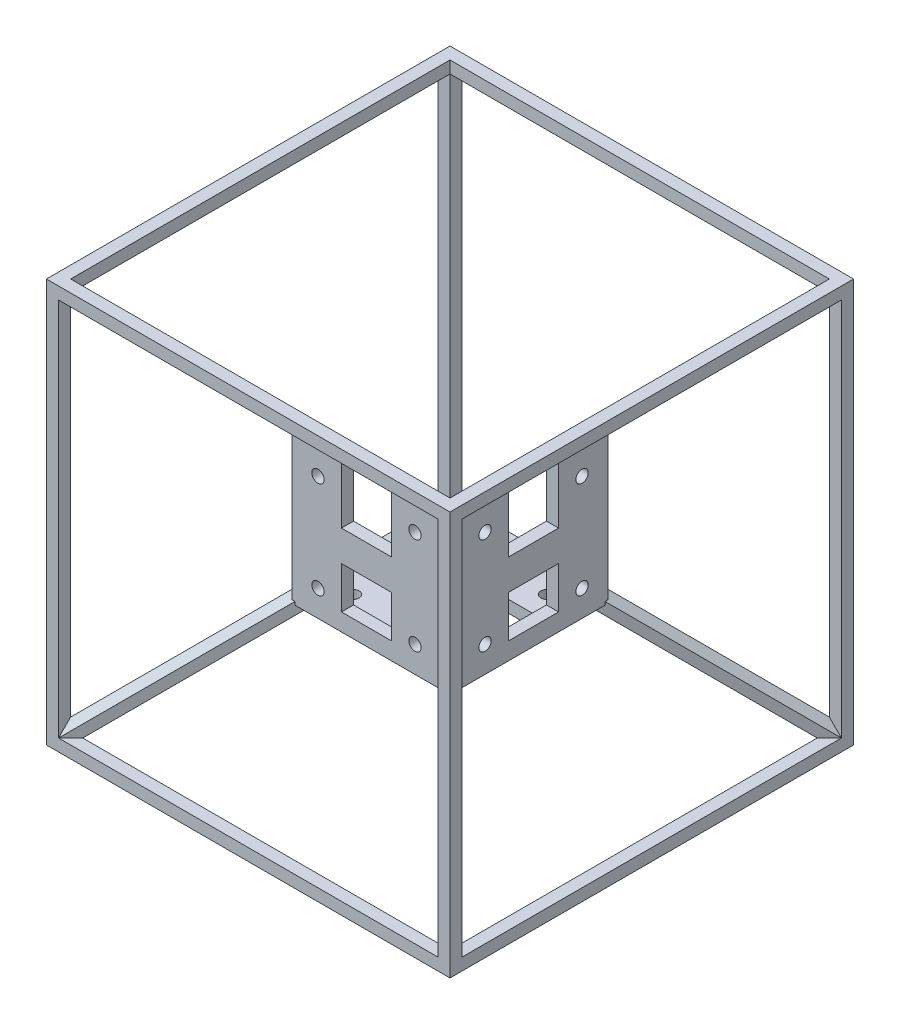
from build123d import *

# Parameters (mm, degrees)
SKETCH1_W               = 100
SKETCH1_H               = 100
SKETCH1_W_2             = 94
SKETCH1_H_2             = 94
BOSS_EXTRUDE1_DEPTH     = 3
SKETCH2_R               = 1.525
SKETCH2_W               = 12.4
SKETCH2_H               = 10.4
BOSS_EXTRUDE3_DEPTH     = 3
BODY_MOVE_COPY2_ANGLE   = 90
BODY_MOVE_COPY2_2_ANGLE = 90
BODY_MOVE_COPY4_ANGLE   = 120
BODY_MOVE_COPY4_2_ANGLE = 120
BODY_MOVE_COPY6_ANGLE   = 180
BODY_MOVE_COPY6_2_ANGLE = 180
BODY_MOVE_COPY6_3_ANGLE = 90
BOSS_EXTRUDE5_DEPTH     = 60
MIRROR4_COPY_1_DEPTH    = 60
MIRROR5_START           = -56.002976111
MIRROR5_DEPTH           = 60
MIRROR5_2_DEPTH         = 60
MIRROR5_START_2         = -110.273901415
MIRROR5_3_DEPTH         = 60
SKETCH7_W               = 36.2
SKETCH7_H               = 36.2
CUT_EXTRUDE1_DEPTH      = 36.2
FILLET3_R               = 2
FILLET4_R               = 1.5
FILLET5_R               = 1.5


with BuildPart() as part:
    # Sketch1 → Boss-Extrude1 (new body)
    with BuildSketch(Plane.XY):
        Rectangle(SKETCH1_W, SKETCH1_H)
        Rectangle(SKETCH1_W_2, SKETCH1_H_2, mode=Mode.SUBTRACT)
    extrude(amount=BOSS_EXTRUDE1_DEPTH)


with BuildPart() as body_2:
    # Sketch2 → Boss-Extrude3 (new body)
    with BuildSketch(Plane(origin=(0, 0, -26.3), x_dir=(-1, 0, 0), z_dir=(0, 0, -1))):
        Polygon((-18.5, 18.5), (-6.2, 18.5), (-6.2, 3.8), (6.2, 3.8), (6.2, 18.5), (18.5, 18.5), (18.5, -18.5), (-18.5, -18.5), align=None)
        with Locations((-12.02081528, 12.02081528)):
            Circle(SKETCH2_R, mode=Mode.SUBTRACT)
        with Locations((12.02081528, 12.02081528)):
            Circle(SKETCH2_R, mode=Mode.SUBTRACT)
        with Locations((12.02081528, -12.02081528)):
            Circle(SKETCH2_R, mode=Mode.SUBTRACT)
        with Locations((-12.02081528, -12.02081528)):
            Circle(SKETCH2_R, mode=Mode.SUBTRACT)
        with Locations((0, -9)):
            Rectangle(SKETCH2_W, SKETCH2_H, mode=Mode.SUBTRACT)
    extrude(amount=BOSS_EXTRUDE3_DEPTH)


with BuildPart() as body_3:
    # Body-Move/Copy2: read off the stored shape, not the designer's step
    # Body-Move/Copy2: copy of part
    add(part.part.moved(Location((26.5, 0, 26.5))).rotate(Axis((0, 0, 0), (0, 1, 0)), BODY_MOVE_COPY2_ANGLE))


with BuildPart() as body_4:
    # Body-Move_Copy2 2: copy of body 2
    add(body_2.part.moved(Location((26.5, 0, 26.5))).rotate(Axis((0, 0, 0), (0, 1, 0)), BODY_MOVE_COPY2_2_ANGLE))


with BuildPart() as body_4_1:
    # Body-Move/Copy3: moved
    add(body_4.part.moved(Location((20.5, 0, -20.5))))


with BuildPart() as body_3_1:
    # Body-Move/Copy3: moved
    add(body_3.part.moved(Location((20.5, 0, -20.5))))


with BuildPart() as body_5:
    # Body-Move/Copy4: read off the stored shape, not the designer's step
    # Body-Move/Copy4: copy of body 2
    add(body_2.part.moved(Location((47, 33.5, 13.5))).rotate(Axis((0, 0, 0), (0.5773502692, 0.5773502692, -0.5773502692)), BODY_MOVE_COPY4_ANGLE))


with BuildPart() as body_6:
    # Body-Move_Copy4 2: copy of part
    add(part.part.moved(Location((47, 33.5, 13.5))).rotate(Axis((0, 0, 0), (0.5773502692, 0.5773502692, -0.5773502692)), BODY_MOVE_COPY4_2_ANGLE))


with BuildPart() as body_6_1:
    # Body-Move/Copy5: moved
    add(body_6.part.moved(Location((-33.5, -33.5, 0))))


with BuildPart() as body_5_1:
    # Body-Move/Copy5: moved
    add(body_5.part.moved(Location((-33.5, -33.5, 0))))


with BuildPart() as body_7:
    # Body-Move/Copy6: read off the stored shape, not the designer's step
    # Body-Move/Copy6: copy of part
    add(part.part.moved(Location((32.3333333, 32.3333333, 61.6666667))).rotate(Axis((0, 0, 0), (1, 0, 0)), BODY_MOVE_COPY6_ANGLE))


with BuildPart() as body_8:
    # Body-Move_Copy6 2: copy of part
    add(part.part.moved(Location((14.6666667, 32.3333333, 14.6666667))).rotate(Axis((0, 0, 0), (0.7071067812, 0, -0.7071067812)), BODY_MOVE_COPY6_2_ANGLE))


with BuildPart() as body_9:
    # Body-Move_Copy6 3: copy of part
    add(part.part.moved(Location((32.3333333, 14.6666667, 14.6666667))).rotate(Axis((0, 0, 0), (-1, 0, 0)), BODY_MOVE_COPY6_3_ANGLE))


with BuildPart() as body_9_1:
    # Body-Move/Copy7: moved
    add(body_9.part.moved(Location((-32.333333333, 32.333333333, -32.333333333))))


with BuildPart() as body_8_1:
    # Body-Move/Copy7: moved
    add(body_8.part.moved(Location((-32.333333333, 32.333333333, -32.333333333))))


with BuildPart() as body_7_1:
    # Body-Move/Copy7: moved
    add(body_7.part.moved(Location((-32.333333333, 32.333333333, -32.333333333))))


with BuildPart() as part_1:
    add(part.part)

    add(body_2.part)  # Boss-Extrude5 merges body 2

    add(body_3_1.part)  # Boss-Extrude5 merges body 3

    add(body_4_1.part)  # Boss-Extrude5 merges body 4

    add(body_5_1.part)  # Boss-Extrude5 merges body 5

    add(body_6_1.part)  # Boss-Extrude5 merges body 6
    # Sketch6 → Boss-Extrude5 (add)
    with BuildSketch(Plane(origin=(32.333333333, -32.333333333, 32.333333333), x_dir=(-0.8164965809277254, -0.4082482904638657, 0.4082482904638618), z_dir=(0.5773502691896268, -0.5773502691896281, 0.5773502691896226))):
        Polygon((-21.637159395, 33.234018716), (-20.412414523, 35.355339059), (-17.96292478, 35.355339059), (-16.738179909, 33.234018716), (-17.96292478, 31.112698372), (-20.412414523, 31.112698372), align=None)
    boss_extrude5 = extrude(amount=-BOSS_EXTRUDE5_DEPTH)

    # Mirror3: Boss-Extrude5 across plane
    add(boss_extrude5.mirror(Plane.ZX))

    # Mirror4: Boss-Extrude5 across plane
    add(boss_extrude5.mirror(Plane.XY.offset(-47)))

    # Mirror4 copy 1 sketch → Mirror4 copy 1 (add)
    with BuildSketch(Plane(origin=(32.333333333, 32.333333333, -126.333333333), x_dir=(-0.8164965809277254, 0.4082482904638657, -0.4082482904638618), z_dir=(0.5773502691896268, 0.5773502691896281, -0.5773502691896226))):
        Polygon((-21.637159395, 33.234018716), (-20.412414523, 35.355339059), (-17.96292478, 35.355339059), (-16.738179909, 33.234018716), (-17.96292478, 31.112698372), (-20.412414523, 31.112698372), align=None)
    extrude(amount=-MIRROR4_COPY_1_DEPTH)

    # Mirror5: read off the stored shape, not the designer's step
    # Mirror5 outline → Mirror5 (add)
    with BuildSketch(Plane(origin=(0, 0, 0), x_dir=(0.8164965809277244, -0.4082482904638664, 0.4082482904638628), z_dir=(0.5773502691896281, 0.5773502691896272, -0.5773502691896221)).offset(MIRROR5_START)):
        Polygon((-17.96292478, 35.355339059), (-20.412414523, 35.355339059), (-21.637159395, 33.234018716), (-20.412414523, 31.112698372), (-17.96292478, 31.112698372), (-16.738179909, 33.234018716), align=None)
    extrude(amount=MIRROR5_DEPTH)

    # Mirror5 2 outline → Mirror5 2 (add)
    with BuildSketch(Plane(origin=(0, 0, 0), x_dir=(0.8164965809277244, 0.4082482904638664, 0.4082482904638628), z_dir=(0.5773502691896281, -0.5773502691896272, -0.5773502691896221)).offset(MIRROR5_START)):
        Polygon((-17.96292478, -31.112698372), (-20.412414523, -31.112698372), (-21.637159395, -33.234018716), (-20.412414523, -35.355339059), (-17.96292478, -35.355339059), (-16.738179909, -33.234018716), align=None)
    extrude(amount=MIRROR5_2_DEPTH)

    # Mirror5 3 outline → Mirror5 3 (add)
    with BuildSketch(Plane(origin=(0, 0, 0), x_dir=(0.8164965809277244, -0.4082482904638664, -0.4082482904638628), z_dir=(0.5773502691896281, 0.5773502691896272, 0.5773502691896221)).offset(MIRROR5_START_2)):
        Polygon((20.412414523, 31.112698372), (21.637159395, 33.234018716), (20.412414523, 35.355339059), (17.96292478, 35.355339059), (16.738179909, 33.234018716), (17.96292478, 31.112698372), align=None)
    extrude(amount=MIRROR5_3_DEPTH)

    # Sketch7 → Cut-Extrude1 (cut)
    with BuildSketch(Plane.ZY.offset(-17.7)):
        with Locations((-47.4, 0.4)):
            Rectangle(SKETCH7_W, SKETCH7_H)
    extrude(amount=CUT_EXTRUDE1_DEPTH, mode=Mode.SUBTRACT)

    # Fillet3
    fillet3_edges = [part_1.edges().sort_by_distance(p)[0] for p in [
        (18.5, -18.5, -57.85),
        (18.5, -18.5, -36.15),
        (0, -18.5, -28.5),
        (18.5, 0, -28.5),
    ]]
    fillet(fillet3_edges, radius=FILLET3_R)

    # Fillet4
    # the kernel refuses this fillet: 1.5 mm, written as the material it takes off along each edge
    with BuildSketch(Plane(origin=(-18.5, -17.7, -31.5), x_dir=(-0.7071067813210047, 2.6890289984470006e-10, 0.7071067810520903), z_dir=(0, 1.0, -3.8028612799414204e-10))) as fillet4_piece_1:
        with BuildLine():
            CenterArc((3.054602815, 1.5), FILLET4_R, 177.87441509, 92.12558491)
            Line((1.555634918, 1.555634919), (0, 0))
            Line((0, 0), (3.054602815, 0))
        make_face()
    extrude(amount=9.836507039, mode=Mode.SUBTRACT)
    with BuildSketch(Plane(origin=(-18.5, -15.499999999, -39.136507039), x_dir=(-8.54266152693293e-13, -1.0, -1.4458914919482245e-10), z_dir=(3.4914813388431337e-15, -1.4458914919482245e-10, 1.0)), Plane(origin=(15.5, -7.863492961, -65.5), x_dir=(1.0, -7.811209981951868e-15, -1.0528951448071048e-12), z_dir=(0, -1, 0))) as fillet4_piece_2:
        with BuildLine():
            CenterArc((3.220590536, -1.099270193), FILLET4_R, 132.874415095, 92.125584901)
            Line((2.159930365, -2.159930365), (0, 0))
            Line((0, 0), (2.2, 0))
        make_face()
    extrude(amount=9.836507039, mode=Mode.SUBTRACT)
    with BuildSketch(Plane(origin=(17.7, -15.5, -65.5), x_dir=(-8.431864652285498e-14, -0.7071067811865127, -0.7071067811865824), z_dir=(-1, 0, 0)), Plane(origin=(7.863492961, 18.5, -31.5), x_dir=(-8.049116928531383e-14, 0.7071067811865916, 0.7071067811865033), z_dir=(1, 0, 0)), Plane(origin=(15.5, 18.5, -29.3), x_dir=(0.7071067811864652, 0.7071067811866297, -1.636191182540943e-13), z_dir=(0, 0, -1))) as fillet4_piece_3:
        with BuildLine():
            CenterArc((3.054602815, 1.5), FILLET4_R, 177.874415108, 92.125584892)
            Line((1.555634919, 1.555634919), (0, 0))
            Line((0, 0), (3.054602815, 0))
        make_face()
    extrude(amount=9.836507039, mode=Mode.SUBTRACT)

    # Fillet5
    # the kernel refuses this fillet: 1.5 mm, written as the material it adds along each edge
    with BuildSketch(Plane(origin=(17.7, 11.75, -65.5), x_dir=(-1, 0, 0), z_dir=(0, 1, 0))) as fillet5_piece_1_section:
        with BuildLine():
            CenterArc((FILLET5_R, FILLET5_R), FILLET5_R, 180, 90)
            Line((0, FILLET5_R), (0, 0))
            Line((0, 0), (FILLET5_R, 0))
        make_face()
    fillet5_piece_1 = extrude(amount=6.75, mode=Mode.PRIVATE)
    fillet5_piece_1 = split(fillet5_piece_1, bisect_by=Plane(origin=(17.7, 13.625, -63.625), z_dir=(-7.940870183631432e-14, 0.7071067811865839, 0.7071067811865112)), keep=Keep.TOP, mode=Mode.PRIVATE)
    add(fillet5_piece_1)
    with BuildSketch(Plane(origin=(17.7, 18.5, -69.25), x_dir=(-1, 0, 0), z_dir=(0, 0, 1))) as fillet5_piece_2_section:
        with BuildLine():
            CenterArc((FILLET5_R, FILLET5_R), FILLET5_R, 180, 90)
            Line((0, FILLET5_R), (0, 0))
            Line((0, 0), (FILLET5_R, 0))
        make_face()
    fillet5_piece_2 = extrude(amount=10.5, mode=Mode.PRIVATE)
    fillet5_piece_2 = split(fillet5_piece_2, bisect_by=Plane(origin=(17.7, 21.875, -65.875), z_dir=(-8.051892486093948e-14, -0.7071067811865039, -0.7071067811865911)), keep=Keep.TOP, mode=Mode.PRIVATE)
    fillet5_piece_2 = split(fillet5_piece_2, bisect_by=Plane(origin=(18.475, 18.5, -68.475), z_dir=(0.7071067811865422, 5.467848396278896e-15, 0.7071067811865531)), keep=Keep.TOP, mode=Mode.PRIVATE)
    fillet5_piece_2 = split(fillet5_piece_2, bisect_by=Plane(origin=(17.7, 18.875, -68.875), z_dir=(-7.940870183631432e-14, 0.7071067811865839, 0.7071067811865112)), keep=Keep.TOP, mode=Mode.PRIVATE)
    add(fillet5_piece_2)
    with BuildSketch(Plane(origin=(-18.5, -17.7, -58.75), x_dir=(1, 0, 0), z_dir=(0, 0, -1))) as fillet5_piece_3_section:
        with BuildLine():
            CenterArc((FILLET5_R, -FILLET5_R), FILLET5_R, 90, 90)
            Line((0, -FILLET5_R), (0, 0))
            Line((0, 0), (FILLET5_R, 0))
        make_face()
    fillet5_piece_3 = extrude(amount=6.75, mode=Mode.PRIVATE)
    fillet5_piece_3 = split(fillet5_piece_3, bisect_by=Plane(origin=(-16.625, -17.7, -60.624999999), z_dir=(0.7071067812797635, -1.8643889210245845e-10, -0.7071067810933318)), keep=Keep.TOP, mode=Mode.PRIVATE)
    add(fillet5_piece_3)
    with BuildSketch(Plane(origin=(-11.75, -17.7, -65.5), x_dir=(0, 0, 1), z_dir=(-1, 0, 0))) as fillet5_piece_4_section:
        with BuildLine():
            CenterArc((FILLET5_R, FILLET5_R), FILLET5_R, 180, 90)
            Line((0, FILLET5_R), (0, 0))
            Line((0, 0), (FILLET5_R, 0))
        make_face()
    fillet5_piece_4 = extrude(amount=6.75, mode=Mode.PRIVATE)
    fillet5_piece_4 = split(fillet5_piece_4, bisect_by=Plane(origin=(-13.624999999, -17.700000001, -63.625), z_dir=(-0.7071067810520923, -2.689028999469656e-10, 0.7071067813210027)), keep=Keep.TOP, mode=Mode.PRIVATE)
    add(fillet5_piece_4)
    with BuildSketch(Plane(origin=(-11.75, 18.5, -29.3), x_dir=(0, 0, -1), z_dir=(-1, 0, 0))) as fillet5_piece_5_section:
        with BuildLine():
            CenterArc((FILLET5_R, FILLET5_R), FILLET5_R, 180, 90)
            Line((0, FILLET5_R), (0, 0))
            Line((0, 0), (FILLET5_R, 0))
        make_face()
    fillet5_piece_5 = extrude(amount=6.75, mode=Mode.PRIVATE)
    fillet5_piece_5 = split(fillet5_piece_5, bisect_by=Plane(origin=(-13.625, 16.625, -29.3), z_dir=(-0.7071067811964302, -0.7071067811766651, -1.9766022152367668e-11)), keep=Keep.TOP, mode=Mode.PRIVATE)
    add(fillet5_piece_5)
    with BuildSketch(Plane(origin=(-18.5, 18.5, -29.3), x_dir=(0, 0, -1), z_dir=(0, -1, 0))) as fillet5_piece_6_section:
        with BuildLine():
            CenterArc((FILLET5_R, FILLET5_R), FILLET5_R, 180, 90)
            Line((0, FILLET5_R), (0, 0))
            Line((0, 0), (FILLET5_R, 0))
        make_face()
    fillet5_piece_6 = extrude(amount=6.75, mode=Mode.PRIVATE)
    fillet5_piece_6 = split(fillet5_piece_6, bisect_by=Plane(origin=(-20, 17, -29.3), z_dir=(0.7071067811354257, 0.7071067812376693, -1.0224240898359938e-10)), keep=Keep.TOP, mode=Mode.PRIVATE)
    add(fillet5_piece_6)

    # Combine5: read off the stored shape, not the designer's step
    # Combine5: union body 8, body 7, body 9
    add(body_8_1.part)
    add(body_7_1.part)
    add(body_9_1.part)


solid = part_1.part
